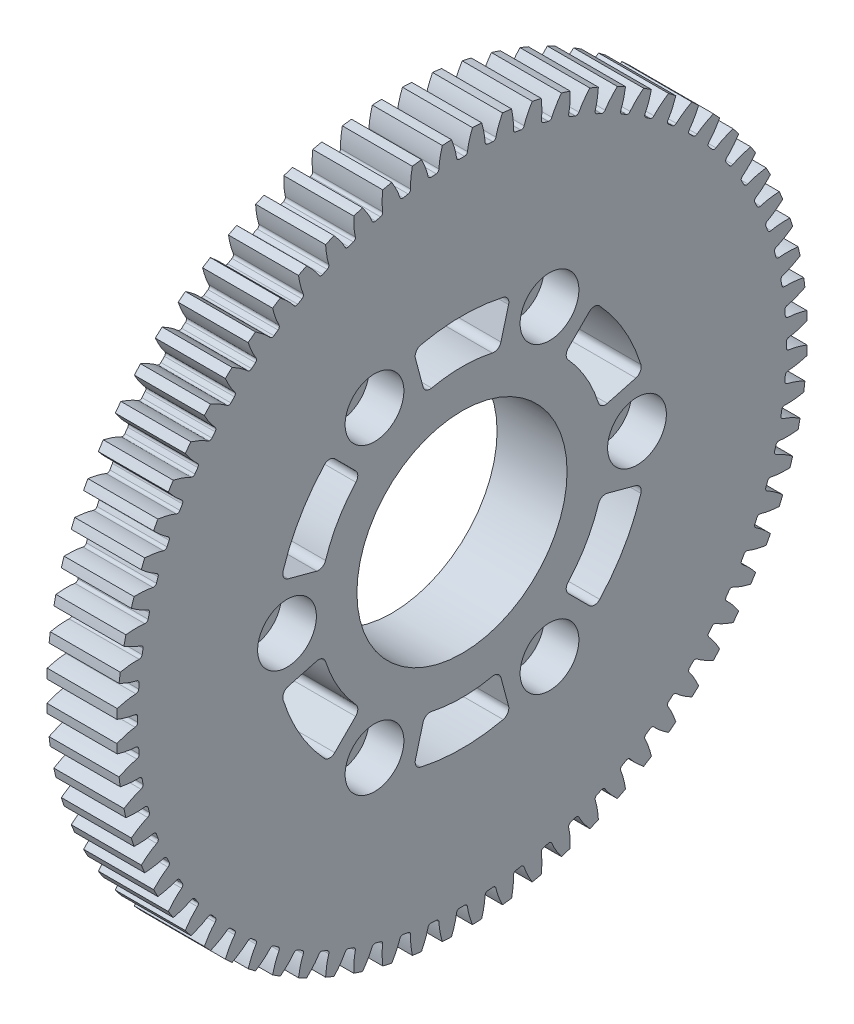
from build123d import *

# Parameters (mm, degrees)
SKETCH1_R                = 46.99
BOSS_EXTRUDE1_DEPTH      = 4.7625
CUT_EXTRUDE1_DEPTH       = 67.624331938
FILLET1_R                = 0.396995651
CIRPATTERN1_COUNT        = 72
FILLET1_OF_CIRPATTERN1_R = 0.396995651
CUT_EXTRUDE3_DEPTH       = 67.593907266
CUT_EXTRUDE3_DEPTH_BACK  = 67.593907266
SKETCH6_R                = 2.1463
SKETCH8_R                = 4.0005
CUT_EXTRUDE5_DEPTH       = 4.7625
FILLET3_R                = 0.9906
CUT_EXTRUDE4_DEPTH       = 67.593907266
CUT_EXTRUDE4_DEPTH_BACK  = 67.593907266
SKETCH7_R                = 14.3002


with BuildPart() as part:
    # Sketch1 → Boss-Extrude1 (new, symmetric)
    with BuildSketch(Plane(origin=(0, 0, 0), x_dir=(0, 0, -1), z_dir=(1, 0, 0))):
        Circle(SKETCH1_R)
    extrude(amount=BOSS_EXTRUDE1_DEPTH, both=True)

    # Sketch2 → Cut-Extrude1 (cut, symmetric)
    with BuildSketch(Plane(origin=(0, 0, 0), x_dir=(0, 0, -1), z_dir=(1, 0, 0))):
        with BuildLine():
            Line((44.257850383, 0.720217253), (44.126657635, 0.718082326))
            ThreePointArc((44.126657635, 0.718082326), (44.1325, 0), (44.126657635, -0.718082326))
            Line((44.126657635, -0.718082326), (44.257850383, -0.720217253))
            add(Edge.make_bspline(
                [(44.257850383, -0.720217253), (44.262004576, -0.720316182), (44.273655377, -0.720690695), (44.295680458, -0.721782042), (44.331626441, -0.724107834), (44.377442193, -0.727873165), (44.43668697, -0.733662081), (44.506521192, -0.74166937), (44.583323647, -0.751715872), (44.666953384, -0.763994538), (44.750457432, -0.777438924), (44.833830328, -0.791964951), (44.916952995, -0.807441836), (45.017731444, -0.827382284), (45.138703811, -0.852952437), (45.280311221, -0.885267739), (45.441177173, -0.924789425), (45.605442227, -0.968155206), (45.767347192, -1.013367392), (45.931272699, -1.061986518), (46.090124068, -1.111110154), (46.255517989, -1.165166973), (46.408380736, -1.216603374), (46.580122343, -1.277609442), (46.718854564, -1.327825568), (46.862593292, -1.382532591), (46.932616855, -1.409577921), (46.968431201, -1.423576669)],
                knots=[0, 0, 0, 0, 0, 0.005376749, 0.015083688, 0.02853182, 0.04661014, 0.06485485, 0.092110526, 0.119476176, 0.146842496, 0.174208854, 0.201574956, 0.228941013, 0.256307345, 0.307035032, 0.361767352, 0.416499661, 0.471231937, 0.525964282, 0.580696616, 0.635428982, 0.690161387, 0.744893688, 0.799626082, 0.854358407, 0.909090914, 0.909090914, 0.909090914, 0.909090914, 0.909090914], degree=4))
            ThreePointArc((46.968431201, -1.423576669), (46.99, 0), (46.968431201, 1.423576669))
            add(Edge.make_bspline(
                [(44.257850383, 0.720217253), (44.262004576, 0.720316182), (44.273655377, 0.720690695), (44.295680458, 0.721782042), (44.331626441, 0.724107834), (44.377442193, 0.727873165), (44.43668697, 0.733662081), (44.506521192, 0.74166937), (44.583323647, 0.751715872), (44.666953384, 0.763994538), (44.750457432, 0.777438924), (44.833830328, 0.791964951), (44.916952995, 0.807441836), (45.017731444, 0.827382284), (45.138703811, 0.852952437), (45.280311221, 0.885267739), (45.441177173, 0.924789425), (45.605442227, 0.968155206), (45.767347192, 1.013367392), (45.931272699, 1.061986518), (46.090124068, 1.111110154), (46.255517989, 1.165166973), (46.408380736, 1.216603374), (46.580122343, 1.277609442), (46.718854564, 1.327825568), (46.862593292, 1.382532591), (46.932616855, 1.409577921), (46.968431201, 1.423576669)],
                knots=[0, 0, 0, 0, 0, 0.005376749, 0.015083688, 0.02853182, 0.04661014, 0.06485485, 0.092110526, 0.119476176, 0.146842496, 0.174208854, 0.201574956, 0.228941013, 0.256307345, 0.307035032, 0.361767352, 0.416499661, 0.471231937, 0.525964282, 0.580696616, 0.635428982, 0.690161387, 0.744893688, 0.799626082, 0.854358407, 0.909090914, 0.909090914, 0.909090914, 0.909090914, 0.909090914], degree=4))
        make_face()
    cut_extrude1 = extrude(amount=CUT_EXTRUDE1_DEPTH, both=True, mode=Mode.SUBTRACT)

    # Fillet1
    fillet1_edges = [part.edges().sort_by_distance(p)[0] for p in [
        (0, -0.718082326, -44.126657635),
        (0, 0.718082326, -44.126657635),
    ]]
    fillet(fillet1_edges, radius=FILLET1_R)

    # CirPattern1: Cut-Extrude1 ×72 about axis
    cirpattern1_axis = Axis((4.7625, 0, 0), (-1, 0, 0))
    for i in range(1, CIRPATTERN1_COUNT):
        add(cut_extrude1.rotate(cirpattern1_axis, i * 360 / CIRPATTERN1_COUNT), mode=Mode.SUBTRACT)

    # Fillet1 of CirPattern1
    fillet1_of_cirpattern1_edges = [part.edges().sort_by_distance(p)[0] for p in [
        (0, -4.561241427, -43.896157382),
        (0, -3.130541815, -44.021327379),
        (0, -8.369686727, -43.331580866),
        (0, -6.955340643, -43.580968241),
        (0, -12.114433656, -42.437224855),
        (0, -10.727205129, -42.808931619),
        (0, -15.766982431, -41.219895939),
        (0, -14.417429106, -41.711093179),
        (0, -19.29953495, -39.688858726),
        (0, -17.997927743, -40.295808135),
        (0, -22.685206354, -37.855765333),
        (0, -21.441451281, -38.573847659),
        (0, -25.898229639, -35.734566708),
        (0, -24.721792429, -36.558316911),
        (0, -28.91415176, -33.341406453),
        (0, -27.813985809, -34.264555296),
        (0, -31.710019727, -30.694497963),
        (0, -30.694497963, -31.710019727),
        (0, -34.264555296, -27.813985809),
        (0, -33.341406453, -28.91415176),
        (0, -36.558316911, -24.721792429),
        (0, -35.734566708, -25.898229639),
        (0, -38.573847659, -21.441451281),
        (0, -37.855765333, -22.685206354),
        (0, -40.295808135, -17.997927743),
        (0, -39.688858726, -19.29953495),
        (0, -41.711093179, -14.417429106),
        (0, -41.219895939, -15.766982431),
        (0, -42.808931619, -10.727205129),
        (0, -42.437224855, -12.114433656),
        (0, -43.580968241, -6.955340643),
        (0, -43.331580866, -8.369686727),
        (0, -44.021327379, -3.130541815),
        (0, -43.896157382, -4.561241427),
        (0, -44.126657635, 0.718082326),
        (0, -44.126657635, -0.718082326),
        (0, -43.896157382, 4.561241427),
        (0, -44.021327379, 3.130541815),
        (0, -43.331580866, 8.369686727),
        (0, -43.580968241, 6.955340643),
        (0, -42.437224855, 12.114433656),
        (0, -42.808931619, 10.727205129),
        (0, -41.219895939, 15.766982431),
        (0, -41.711093179, 14.417429106),
        (0, -39.688858726, 19.29953495),
        (0, -40.295808135, 17.997927743),
        (0, -37.855765333, 22.685206354),
        (0, -38.573847659, 21.441451281),
        (0, -35.734566708, 25.898229639),
        (0, -36.558316911, 24.721792429),
        (0, -33.341406453, 28.91415176),
        (0, -34.264555296, 27.813985809),
        (0, -30.694497963, 31.710019727),
        (0, -31.710019727, 30.694497963),
        (0, -27.813985809, 34.264555296),
        (0, -28.91415176, 33.341406453),
        (0, -24.721792429, 36.558316911),
        (0, -25.898229639, 35.734566708),
        (0, -21.441451281, 38.573847659),
        (0, -22.685206354, 37.855765333),
        (0, -17.997927743, 40.295808135),
        (0, -19.29953495, 39.688858726),
        (0, -14.417429106, 41.711093179),
        (0, -15.766982431, 41.219895939),
        (0, -10.727205129, 42.808931619),
        (0, -12.114433656, 42.437224855),
        (0, -6.955340643, 43.580968241),
        (0, -8.369686727, 43.331580866),
        (0, -3.130541815, 44.021327379),
        (0, -4.561241427, 43.896157382),
        (0, 0.718082326, 44.126657635),
        (0, -0.718082326, 44.126657635),
        (0, 4.561241427, 43.896157382),
        (0, 3.130541815, 44.021327379),
        (0, 8.369686727, 43.331580866),
        (0, 6.955340643, 43.580968241),
        (0, 12.114433656, 42.437224855),
        (0, 10.727205129, 42.808931619),
        (0, 15.766982431, 41.219895939),
        (0, 14.417429106, 41.711093179),
        (0, 19.29953495, 39.688858726),
        (0, 17.997927743, 40.295808135),
        (0, 22.685206354, 37.855765333),
        (0, 21.441451281, 38.573847659),
        (0, 25.898229639, 35.734566708),
        (0, 24.721792429, 36.558316911),
        (0, 28.91415176, 33.341406453),
        (0, 27.813985809, 34.264555296),
        (0, 31.710019727, 30.694497963),
        (0, 30.694497963, 31.710019727),
        (0, 34.264555296, 27.813985809),
        (0, 33.341406453, 28.91415176),
        (0, 36.558316911, 24.721792429),
        (0, 35.734566708, 25.898229639),
        (0, 38.573847659, 21.441451281),
        (0, 37.855765333, 22.685206354),
        (0, 40.295808135, 17.997927743),
        (0, 39.688858726, 19.29953495),
        (0, 41.711093179, 14.417429106),
        (0, 41.219895939, 15.766982431),
        (0, 42.808931619, 10.727205129),
        (0, 42.437224855, 12.114433656),
        (0, 43.580968241, 6.955340643),
        (0, 43.331580866, 8.369686727),
        (0, 44.021327379, 3.130541815),
        (0, 43.896157382, 4.561241427),
        (0, 44.126657635, -0.718082326),
        (0, 44.126657635, 0.718082326),
        (0, 43.896157382, -4.561241427),
        (0, 44.021327379, -3.130541815),
        (0, 43.331580866, -8.369686727),
        (0, 43.580968241, -6.955340643),
        (0, 42.437224855, -12.114433656),
        (0, 42.808931619, -10.727205129),
        (0, 41.219895939, -15.766982431),
        (0, 41.711093179, -14.417429106),
        (0, 39.688858726, -19.29953495),
        (0, 40.295808135, -17.997927743),
        (0, 37.855765333, -22.685206354),
        (0, 38.573847659, -21.441451281),
        (0, 35.734566708, -25.898229639),
        (0, 36.558316911, -24.721792429),
        (0, 33.341406453, -28.91415176),
        (0, 34.264555296, -27.813985809),
        (0, 30.694497963, -31.710019727),
        (0, 31.710019727, -30.694497963),
        (0, 27.813985809, -34.264555296),
        (0, 28.91415176, -33.341406453),
        (0, 24.721792429, -36.558316911),
        (0, 25.898229639, -35.734566708),
        (0, 21.441451281, -38.573847659),
        (0, 22.685206354, -37.855765333),
        (0, 17.997927743, -40.295808135),
        (0, 19.29953495, -39.688858726),
        (0, 14.417429106, -41.711093179),
        (0, 15.766982431, -41.219895939),
        (0, 10.727205129, -42.808931619),
        (0, 12.114433656, -42.437224855),
        (0, 6.955340643, -43.580968241),
        (0, 8.369686727, -43.331580866),
        (0, 3.130541815, -44.021327379),
        (0, 4.561241427, -43.896157382),
    ]]
    fillet(fillet1_of_cirpattern1_edges, radius=FILLET1_OF_CIRPATTERN1_R)

    # Sketch6 → Cut-Extrude3 (cut, two sides: drawn at the far end of the back side and taken through both)
    with BuildSketch(Plane(origin=(0, 0, 0), x_dir=(0, 0, -1), z_dir=(1, 0, 0)).offset(-CUT_EXTRUDE3_DEPTH_BACK)):
        with Locations((-11.90625, 20.622229928)):
            Circle(SKETCH6_R)
        with Locations((11.90625, 20.622229928)):
            Circle(SKETCH6_R)
        with Locations((23.8125, 0)):
            Circle(SKETCH6_R)
        with Locations((11.90625, -20.622229928)):
            Circle(SKETCH6_R)
        with Locations((-11.90625, -20.622229928)):
            Circle(SKETCH6_R)
        with Locations((-23.8125, 0)):
            Circle(SKETCH6_R)
        with BuildLine():
            Line((-6.59988565, 24.63110857), (-5.046971379, 18.835553613))
            ThreePointArc((-5.046971379, 18.835553613), (0, 19.5), (5.046971379, 18.835553613))
            Line((5.046971379, 18.835553613), (6.59988565, 24.63110857))
            ThreePointArc((6.59988565, 24.63110857), (0, 25.5), (-6.59988565, 24.63110857))
        make_face()
        with BuildLine():
            Line((18.03122292, 18.03122292), (13.788582233, 13.788582233))
            ThreePointArc((13.788582233, 13.788582233), (16.887495374, 9.75), (18.835553613, 5.046971379))
            Line((18.835553613, 5.046971379), (24.63110857, 6.59988565))
            ThreePointArc((24.63110857, 6.59988565), (22.083647797, 12.75), (18.03122292, 18.03122292))
        make_face()
        with BuildLine():
            Line((24.63110857, -6.59988565), (18.835553613, -5.046971379))
            ThreePointArc((18.835553613, -5.046971379), (16.887495374, -9.75), (13.788582233, -13.788582233))
            Line((13.788582233, -13.788582233), (18.03122292, -18.03122292))
            ThreePointArc((18.03122292, -18.03122292), (22.083647797, -12.75), (24.63110857, -6.59988565))
        make_face()
        with BuildLine():
            Line((6.59988565, -24.63110857), (5.046971379, -18.835553613))
            ThreePointArc((5.046971379, -18.835553613), (0, -19.5), (-5.046971379, -18.835553613))
            Line((-5.046971379, -18.835553613), (-6.59988565, -24.63110857))
            ThreePointArc((-6.59988565, -24.63110857), (0, -25.5), (6.59988565, -24.63110857))
        make_face()
        with BuildLine():
            Line((-18.03122292, -18.03122292), (-13.788582233, -13.788582233))
            ThreePointArc((-13.788582233, -13.788582233), (-16.887495374, -9.75), (-18.835553613, -5.046971379))
            Line((-18.835553613, -5.046971379), (-24.63110857, -6.59988565))
            ThreePointArc((-24.63110857, -6.59988565), (-22.083647797, -12.75), (-18.03122292, -18.03122292))
        make_face()
        with BuildLine():
            Line((-24.63110857, 6.59988565), (-18.835553613, 5.046971379))
            ThreePointArc((-18.835553613, 5.046971379), (-16.887495374, 9.75), (-13.788582233, 13.788582233))
            Line((-13.788582233, 13.788582233), (-18.03122292, 18.03122292))
            ThreePointArc((-18.03122292, 18.03122292), (-22.083647797, 12.75), (-24.63110857, 6.59988565))
        make_face()
    extrude(amount=CUT_EXTRUDE3_DEPTH + CUT_EXTRUDE3_DEPTH_BACK, mode=Mode.SUBTRACT)

    # Sketch8 → Cut-Extrude5 (cut)
    with BuildSketch(Plane(origin=(4.7625, 0, 0), x_dir=(0, 0, -1), z_dir=(1, 0, 0))):
        with Locations((-11.90625, 20.622229928)):
            Circle(SKETCH8_R)
        with Locations((11.90625, 20.622229928)):
            Circle(SKETCH8_R)
        with Locations((23.8125, 0)):
            Circle(SKETCH8_R)
        with Locations((11.90625, -20.622229928)):
            Circle(SKETCH8_R)
        with Locations((-11.90625, -20.622229928)):
            Circle(SKETCH8_R)
        with Locations((-23.8125, 0)):
            Circle(SKETCH8_R)
    extrude(amount=-CUT_EXTRUDE5_DEPTH, mode=Mode.SUBTRACT)

    # Fillet3
    fillet3_edges = [part.edges().sort_by_distance(p)[0] for p in [
        (0, 13.788582233, 13.788582233),
        (0, 5.046971379, 18.835553613),
        (0, 6.59988565, 24.63110857),
        (0, 18.03122292, 18.03122292),
        (0, -5.046971379, 18.835553613),
        (0, -13.788582233, 13.788582233),
        (0, -18.03122292, 18.03122292),
        (0, -6.59988565, 24.63110857),
        (0, -18.835553613, 5.046971379),
        (0, -18.835553613, -5.046971379),
        (0, -24.63110857, -6.59988565),
        (0, -24.63110857, 6.59988565),
        (0, 18.835553613, -5.046971379),
        (0, 24.63110857, 6.59988565),
        (0, 24.63110857, -6.59988565),
        (0, 5.046971379, -18.835553613),
        (0, 13.788582233, -13.788582233),
        (0, 18.03122292, -18.03122292),
        (0, 6.59988565, -24.63110857),
        (0, -13.788582233, -13.788582233),
        (0, -5.046971379, -18.835553613),
        (0, -6.59988565, -24.63110857),
        (0, -18.03122292, -18.03122292),
        (0, 18.835553613, 5.046971379),
    ]]
    fillet(fillet3_edges, radius=FILLET3_R)

    # Sketch7 → Cut-Extrude4 (cut, two sides: drawn at the far end of the back side and taken through both)
    with BuildSketch(Plane(origin=(0, 0, 0), x_dir=(0, 0, -1), z_dir=(1, 0, 0)).offset(-CUT_EXTRUDE4_DEPTH_BACK)):
        Circle(SKETCH7_R)
    extrude(amount=CUT_EXTRUDE4_DEPTH + CUT_EXTRUDE4_DEPTH_BACK, mode=Mode.SUBTRACT)


solid = part.part
